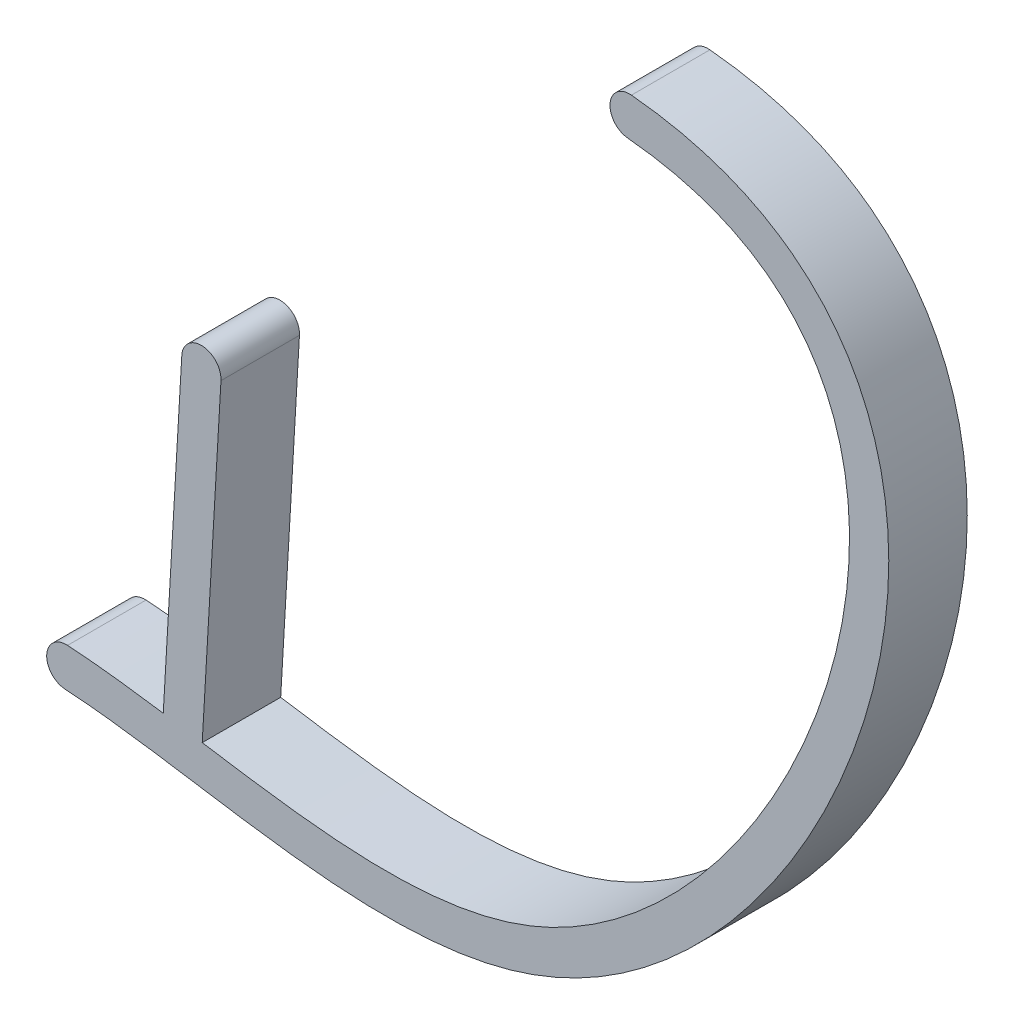
from build123d import *

# Parameters (mm, degrees)
BOSS_EXTRUDE1_DEPTH = 6.35


with BuildPart() as part:
    # Sketch1 → Boss-Extrude1 (new body)
    with BuildSketch(Plane.XY):
        with BuildLine():
            ThreePointArc((-22.774359986, -45.318391778), (-24.267104207, -43.641481764), (-25.94401422, -45.134225984))
            add(Edge.make_bspline(
                [(-27.444502047, -70.958932701), (-26.944339438, -62.350697129), (-26.444176829, -53.742461557), (-25.94401422, -45.134225984)],
                knots=[0.063086076, 0.063086076, 0.063086076, 0.063086076, 1, 1, 1, 1], degree=3))
            add(Edge.make_bspline(
                [(-27.444502047, -70.958932701), (-27.667584627, -70.925825336), (-29.087852596, -70.717266549), (-31.691634695, -70.366443503), (-34.015196273, -70.147232186), (-35.188030924, -70.073770107)],
                knots=[0.931682183, 0.931682183, 0.931682183, 0.931682183, 0.9375, 0.96875, 1, 1, 1, 1], degree=3))
            ThreePointArc((-35.188030924, -70.073770107), (-36.871666645, -71.558924396), (-35.386512356, -73.242560116))
            add(Edge.make_bspline(
                [(10.436686233, -8.706572753), (10.852839449, -8.745987669), (11.692323348, -8.840021278), (13.296107434, -9.078249188), (15.208822195, -9.473217448), (17.344029202, -10.096754595), (19.984748784, -11.121746832), (22.898208719, -12.753364333), (25.771789241, -15.21940015), (28.020631501, -18.120344827), (30.206953266, -22.457711788), (31.501494897, -28.558585134), (31.091250812, -36.489221842), (29.006317708, -44.649521375), (25.486309181, -52.656678897), (20.750984157, -60.11926782), (15.001290176, -66.631132946), (8.438310884, -71.794647149), (1.18548159, -75.112924538), (-6.34702946, -76.310611384), (-13.916654187, -76.123991753), (-20.146764373, -75.303971787), (-25.01321999, -74.542683224), (-28.586049194, -73.98851292), (-31.478243267, -73.598742839), (-33.737708402, -73.363227057), (-34.833506251, -73.277198399), (-35.386512356, -73.242560116)],
                knots=[0, 0, 0, 0, 0.0078125, 0.015625, 0.03125, 0.046875, 0.0625, 0.09375, 0.125, 0.15625, 0.1875, 0.25, 0.3125, 0.375, 0.4375, 0.5, 0.5625, 0.625, 0.6875, 0.75, 0.8125, 0.875, 0.90625, 0.9375, 0.96875, 0.984375, 1, 1, 1, 1], degree=3))
            ThreePointArc((10.436686233, -8.706572753), (8.706572753, -10.137313767), (10.137313767, -11.867427247))
            add(Edge.make_bspline(
                [(10.137313767, -11.867427247), (10.516756343, -11.903365206), (11.284074622, -11.989328646), (12.73506962, -12.205009849), (14.447601566, -12.559122699), (16.328292246, -13.109044215), (18.616838452, -13.998349504), (21.07956766, -15.381999176), (23.457575669, -17.425413884), (25.315183651, -19.820149285), (27.150956281, -23.452197944), (28.297120103, -28.754398589), (27.938286369, -35.974652111), (25.997414278, -43.593638899), (22.675766229, -51.155055858), (18.195681974, -58.212351626), (12.793742904, -64.329486096), (7.735165994, -68.286273123), (3.487875081, -70.573052541), (-0.844965514, -72.201070959), (-6.516814084, -73.125151848), (-13.628974527, -72.956059942), (-19.608742956, -72.172941901), (-23.159773414, -71.618831953), (-24.292232796, -71.442309237)],
                knots=[0, 0, 0, 0, 0.0078125, 0.015625, 0.03125, 0.046875, 0.0625, 0.09375, 0.125, 0.15625, 0.1875, 0.25, 0.3125, 0.375, 0.4375, 0.5, 0.5625, 0.625, 0.65625, 0.6875, 0.75, 0.8125, 0.875, 0.904364455, 0.904364455, 0.904364455, 0.904364455], degree=3))
            add(Edge.make_bspline(
                [(-24.292232796, -71.442309237), (-23.786275193, -62.734336751), (-23.28031759, -54.026364264), (-22.774359986, -45.318391778)],
                knots=[0.052230785, 0.052230785, 0.052230785, 0.052230785, 1, 1, 1, 1], degree=3))
        make_face()
    extrude(amount=BOSS_EXTRUDE1_DEPTH)


solid = part.part
